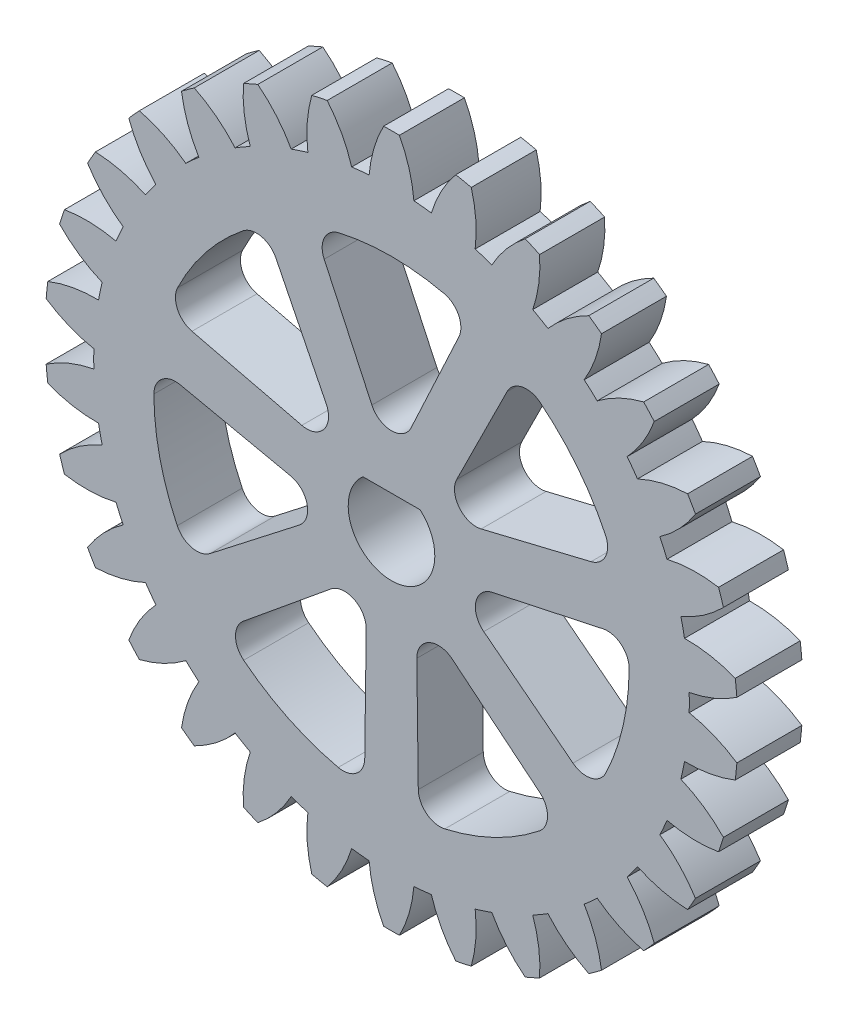
from build123d import *

# Parameters (mm, degrees)
SKETCH1_R                = 16
BOSS_EXTRUDE1_DEPTH      = 3
CUT_EXTRUDE1_DEPTH       = 23.825424421
CIRPATTERN1_COUNT        = 30
CUT_EXTRUDE3_DEPTH       = 23.787803159
FILLET6_R                = 1
CIRPATTERN3_COUNT        = 7
FILLET6_OF_CIRPATTERN3_R = 1
CUT_EXTRUDE4_DEPTH       = 10


with BuildPart() as part:
    # Sketch1 → Boss-Extrude1 (new body)
    with BuildSketch(Plane.XY):
        Circle(SKETCH1_R)
    extrude(amount=BOSS_EXTRUDE1_DEPTH)

    # Sketch2 → Cut-Extrude1 (cut, through all)
    with BuildSketch(Plane(origin=(0, 0, 0), x_dir=(-1, 0, 0), z_dir=(0, 0, -1))):
        with BuildLine():
            ThreePointArc((1.033599147, 13.711096703), (1.43726637, 13.674676061), (1.839684773, 13.62637369))
            ThreePointArc((1.839684773, 13.62637369), (2.299671997, 14.730795869), (2.969636607, 15.721999187))
            ThreePointArc((2.969636607, 15.721999187), (1.672455412, 15.912350326), (0.364044512, 15.995857951))
            ThreePointArc((0.364044512, 15.995857951), (0.813286029, 14.887021329), (1.033599147, 13.711096703))
        make_face()
    cut_extrude1 = extrude(amount=-CUT_EXTRUDE1_DEPTH, mode=Mode.SUBTRACT)

    # CirPattern1: Cut-Extrude1 ×30 about axis
    cirpattern1_axis = Axis((0, 0, 0), (0, 0, 1))
    for i in range(1, CIRPATTERN1_COUNT):
        add(cut_extrude1.rotate(cirpattern1_axis, i * 360 / CIRPATTERN1_COUNT), mode=Mode.SUBTRACT)

    # Sketch4 → Cut-Extrude3 (cut, through all)
    with BuildSketch(Plane(origin=(0, 0, 0), x_dir=(-1, 0, 0), z_dir=(0, 0, -1))):
        with BuildLine():
            Line((0, 2.628598969), (3.602412301, 10.364256885))
            ThreePointArc((3.602412301, 10.364256885), (0, 10.972474432), (-3.602412301, 10.364256885))
            Line((-3.602412301, 10.364256885), (0, 2.628598969))
        make_face()
    cut_extrude3 = extrude(amount=-CUT_EXTRUDE3_DEPTH, mode=Mode.SUBTRACT)

    # Fillet6
    fillet6_edges = [part.edges().sort_by_distance(p)[0] for p in [
        (0, 2.628598969, 1.5),
        (-3.602412301, 10.364256885, 1.5),
        (3.602412301, 10.364256885, 1.5),
    ]]
    fillet(fillet6_edges, radius=FILLET6_R)

    # CirPattern3: Cut-Extrude3 ×7 about axis
    cirpattern3_axis = Axis((0, 0, 0), (0, 0, 1))
    for i in range(1, CIRPATTERN3_COUNT):
        add(cut_extrude3.rotate(cirpattern3_axis, i * 360 / CIRPATTERN3_COUNT), mode=Mode.SUBTRACT)

    # Fillet6 of CirPattern3
    fillet6_of_cirpattern3_edges = [part.edges().sort_by_distance(p)[0] for p in [
        (-2.055121428, 1.63890465, 1.5),
        (-10.349169656, 3.645529122, 1.5),
        (-5.857034993, 9.278487821, 1.5),
        (-2.562694504, -0.584918297, 1.5),
        (-9.302791176, -5.818356425, 1.5),
        (-10.906015475, 1.205828182, 1.5),
        (-1.140506349, -2.368285837, 1.5),
        (-1.251221198, -10.900900911, 1.5),
        (-7.742543863, -7.774844673, 1.5),
        (1.140506349, -2.368285837, 1.5),
        (7.742543863, -7.774844673, 1.5),
        (1.251221198, -10.900900911, 1.5),
        (2.562694504, -0.584918297, 1.5),
        (10.906015475, 1.205828182, 1.5),
        (9.302791176, -5.818356425, 1.5),
        (2.055121428, 1.63890465, 1.5),
        (5.857034993, 9.278487821, 1.5),
        (10.349169656, 3.645529122, 1.5),
    ]]
    fillet(fillet6_of_cirpattern3_edges, radius=FILLET6_OF_CIRPATTERN3_R)

    # Sketch5 → Cut-Extrude4 (cut)
    with BuildSketch(Plane(origin=(0, 0, 0), x_dir=(-1, 0, 0), z_dir=(0, 0, -1))):
        with BuildLine():
            Line((-1.322875656, 1.5), (1.322875656, 1.5))
            ThreePointArc((1.322875656, 1.5), (0, -2), (-1.322875656, 1.5))
        make_face()
    extrude(amount=-CUT_EXTRUDE4_DEPTH, mode=Mode.SUBTRACT)


solid = part.part
